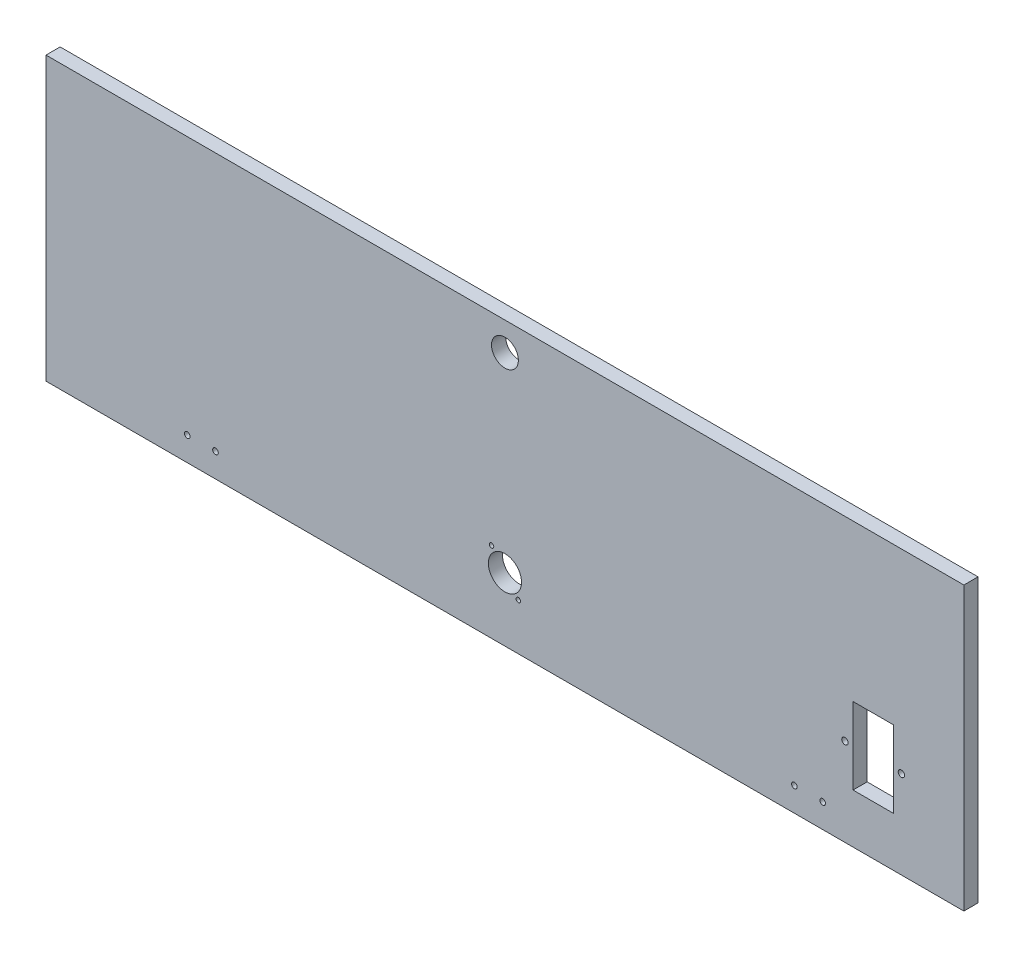
from build123d import *

# Parameters (mm, degrees)
ESQUISSE1_W             = 650
ESQUISSE1_H             = 200
BOSS_EXTRU_1_DEPTH      = 10
ESQUISSE2_R             = 2
ENL_V_MAT_EXTRU_1_DEPTH = 10
ESQUISSE3_R             = 1.6
ESQUISSE3_R_2           = 11.75
ESQUISSE3_W             = 28.5
ESQUISSE3_H             = 54.3
ESQUISSE3_R_3           = 2.25
ENL_V_MAT_EXTRU_2_DEPTH = 10
ESQUISSE4_R             = 9.5
ENL_V_MAT_EXTRU_3_DEPTH = 10
ESQUISSE5_R             = 1
ENL_V_MAT_EXTRU_4_DEPTH = 2


with BuildPart() as part:
    # Esquisse1 → Boss.-Extru.1 (new body)
    with BuildSketch(Plane.XY):
        with Locations((325, 100)):
            Rectangle(ESQUISSE1_W, ESQUISSE1_H)
    extrude(amount=BOSS_EXTRU_1_DEPTH)

    # Esquisse2 → Enlèv. mat.-Extru.1 (cut)
    with BuildSketch(Plane.XY.offset(10)):
        with Locations((100, 17)):
            Circle(ESQUISSE2_R)
        with Locations((120, 17)):
            Circle(ESQUISSE2_R)
        with Locations((530, 17)):
            Circle(ESQUISSE2_R)
        with Locations((550, 17)):
            Circle(ESQUISSE2_R)
    extrude(amount=-ENL_V_MAT_EXTRU_1_DEPTH, mode=Mode.SUBTRACT)

    # Esquisse3 → Enlèv. mat.-Extru.2 (cut)
    with BuildSketch(Plane.XY.offset(10)):
        with Locations((315.499614794, 56.999404399)):
            Circle(ESQUISSE3_R)
        with Locations((325, 45)):
            Circle(ESQUISSE3_R_2)
        with Locations((334.500385206, 33.000595601)):
            Circle(ESQUISSE3_R)
        with Locations((585.75, 62.15)):
            Rectangle(ESQUISSE3_W, ESQUISSE3_H)
        with Locations((565.75, 62.15)):
            Circle(ESQUISSE3_R_3)
        with Locations((605.75, 62.15)):
            Circle(ESQUISSE3_R_3)
    extrude(amount=-ENL_V_MAT_EXTRU_2_DEPTH, mode=Mode.SUBTRACT)

    # Esquisse4 → Enlèv. mat.-Extru.3 (cut)
    with BuildSketch(Plane.XY.offset(10)):
        with Locations((325, 180)):
            Circle(ESQUISSE4_R)
    extrude(amount=-ENL_V_MAT_EXTRU_3_DEPTH, mode=Mode.SUBTRACT)

    # Esquisse5 → Enlèv. mat.-Extru.4 (cut)
    with BuildSketch(Plane.XY):
        with Locations((341, 180)):
            Circle(ESQUISSE5_R)
        with Locations((309, 180)):
            Circle(ESQUISSE5_R)
        with Locations((40, 190)):
            Circle(ESQUISSE5_R)
        with Locations((20, 190)):
            Circle(ESQUISSE5_R)
        with Locations((630, 190)):
            Circle(ESQUISSE5_R)
        with Locations((610, 190)):
            Circle(ESQUISSE5_R)
    extrude(amount=ENL_V_MAT_EXTRU_4_DEPTH, mode=Mode.SUBTRACT)


solid = part.part
